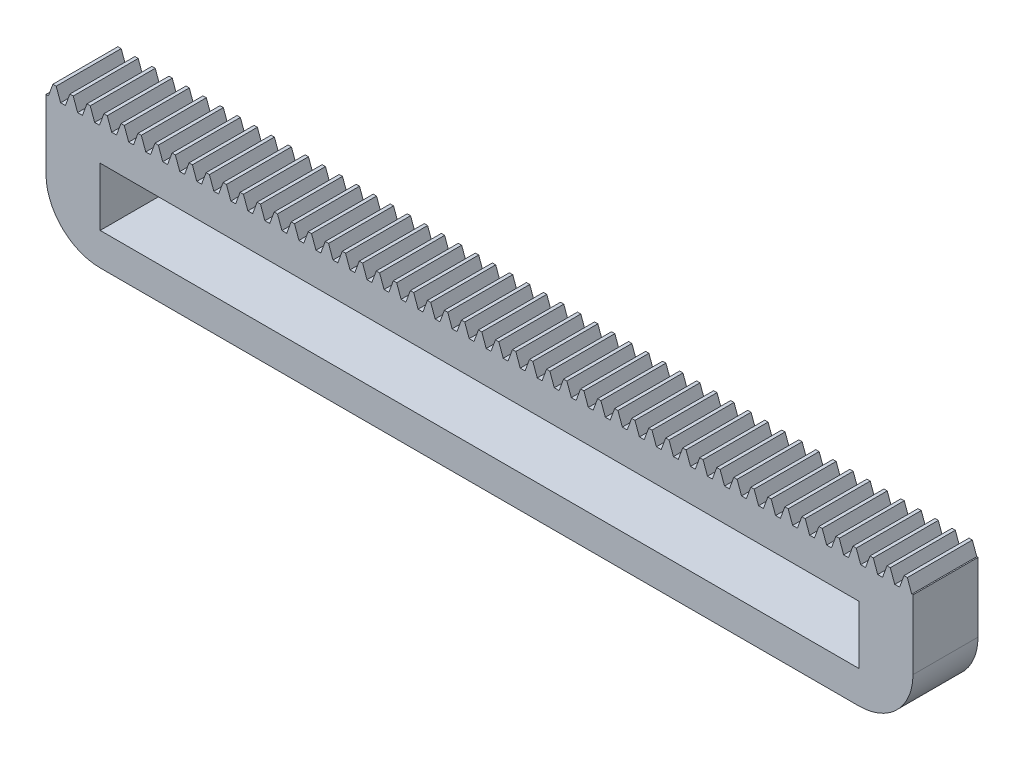
from build123d import *

# Parameters (mm, degrees)
BLANKSKE_W          = 80
BLANKSKE_H          = 12.5
BLANK_DEPTH         = 6
TOOTHCUTSIM_DEPTH   = 82.192672083
TEETHCUTS_COUNT     = 129
TEETHCUTS_PITCH     = 1.570796325
SKETCH1_W           = 80
SKETCH1_H           = 6
BOSS_EXTRUDE1_DEPTH = 10
SKETCH4_W           = 88.884112985
SKETCH4_H           = 15.47203355
CUT_EXTRUDE3_DEPTH  = 82.192672083
SKETCH3_W           = 70
SKETCH3_H           = 5.375
CUT_EXTRUDE2_DEPTH  = 10
FILLET3_R           = 5


with BuildPart() as part:
    # BlankSke → Blank (new body)
    with BuildSketch(Plane.XY):
        with Locations((40, 6.25)):
            Rectangle(BLANKSKE_W, BLANKSKE_H)
    extrude(amount=-BLANK_DEPTH)

    # TooCutSkeSim → ToothCutSim (cut, through all)
    with BuildSketch(Plane.XY):
        Polygon((0.222217685, 11.375), (-0.222217685, 11.375), (-0.640929042, 12.5254), (0.640929042, 12.5254), align=None)
    toothcutsim = extrude(amount=-TOOTHCUTSIM_DEPTH, mode=Mode.SUBTRACT)

    # TeethCuts: ToothCutSim ×129
    with Locations(*[(i * TEETHCUTS_PITCH, 0, 0) for i in range(1, TEETHCUTS_COUNT)]):
        add(toothcutsim, mode=Mode.SUBTRACT)

    # Sketch1 → Boss-Extrude1 (add)
    with BuildSketch(Plane.XZ):
        with Locations((40, -3)):
            Rectangle(SKETCH1_W, SKETCH1_H)
    extrude(amount=BOSS_EXTRUDE1_DEPTH)

    # Sketch4 → Cut-Extrude3 (cut, through all)
    with BuildSketch(Plane.XY):
        with Locations((41.448981395, -7.736016775)):
            Rectangle(SKETCH4_W, SKETCH4_H)
    extrude(amount=-CUT_EXTRUDE3_DEPTH, mode=Mode.SUBTRACT)

    # Sketch3 → Cut-Extrude2 (cut)
    with BuildSketch(Plane.XY):
        with Locations((40, 5.6875)):
            Rectangle(SKETCH3_W, SKETCH3_H)
    extrude(amount=-CUT_EXTRUDE2_DEPTH, mode=Mode.SUBTRACT)

    # Fillet3
    fillet3_edges = [part.edges().sort_by_distance(p)[0] for p in [
        (80, 0, -3),
        (0, 0, -3),
    ]]
    fillet(fillet3_edges, radius=FILLET3_R)


solid = part.part
